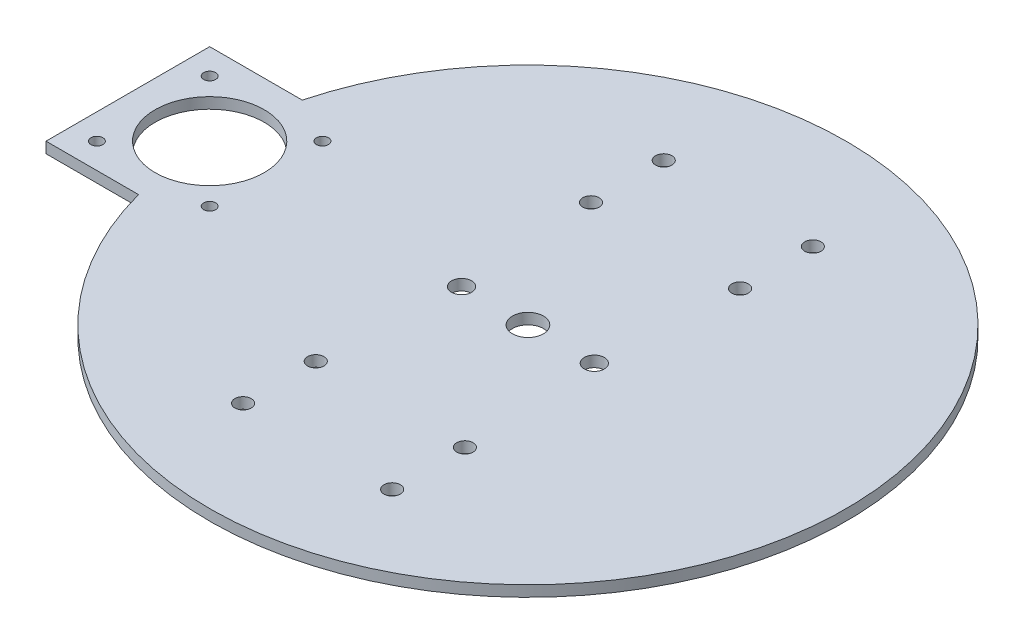
from build123d import *

# Parameters (mm, degrees)
SKETCH2_R           = 15
SKETCH2_R_2         = 1.65
SKETCH2_R_3         = 2.25
SKETCH2_R_4         = 2.75
SKETCH2_R_5         = 4.25
BOSS_EXTRUDE3_DEPTH = 3


with BuildPart() as part:
    # Sketch2 → Boss-Extrude3 (new body)
    with BuildSketch(Plane(origin=(0, 0, 0), x_dir=(1, 0, 0), z_dir=(0, 1, 0))):
        with BuildLine():
            Line((-84.557672626, 22.5), (-110, 22.5))
            Line((-110, 22.5), (-110, -22.5))
            Line((-110, -22.5), (-84.557672626, -22.5))
            ThreePointArc((-84.557672626, -22.5), (87.5, 0), (-84.557672626, 22.5))
        make_face()
        with Locations((-87.5, 0)):
            Circle(SKETCH2_R, mode=Mode.SUBTRACT)
        with Locations((-103, -15.5)):
            Circle(SKETCH2_R_2, mode=Mode.SUBTRACT)
        with Locations((-103, 15.5)):
            Circle(SKETCH2_R_2, mode=Mode.SUBTRACT)
        with Locations((-72, -15.5)):
            Circle(SKETCH2_R_2, mode=Mode.SUBTRACT)
        with Locations((-20.5, -37.830207885)):
            Circle(SKETCH2_R_3, mode=Mode.SUBTRACT)
        with Locations((20.5, -37.830207885)):
            Circle(SKETCH2_R_3, mode=Mode.SUBTRACT)
        with Locations((-72, 15.5)):
            Circle(SKETCH2_R_2, mode=Mode.SUBTRACT)
        with Locations((-18.25, 0)):
            Circle(SKETCH2_R_4, mode=Mode.SUBTRACT)
        with Locations((-20.5, 37.830207885)):
            Circle(SKETCH2_R_3, mode=Mode.SUBTRACT)
        Circle(SKETCH2_R_5, mode=Mode.SUBTRACT)
        with Locations((18.25, 0)):
            Circle(SKETCH2_R_4, mode=Mode.SUBTRACT)
        with Locations((20.5, 37.830207885)):
            Circle(SKETCH2_R_3, mode=Mode.SUBTRACT)
        with Locations((-20.5, -57.830207885)):
            Circle(SKETCH2_R_3, mode=Mode.SUBTRACT)
        with Locations((20.5, -57.830207885)):
            Circle(SKETCH2_R_3, mode=Mode.SUBTRACT)
        with Locations((-20.5, 57.830207885)):
            Circle(SKETCH2_R_3, mode=Mode.SUBTRACT)
        with Locations((20.5, 57.830207885)):
            Circle(SKETCH2_R_3, mode=Mode.SUBTRACT)
    extrude(amount=BOSS_EXTRUDE3_DEPTH)


solid = part.part
